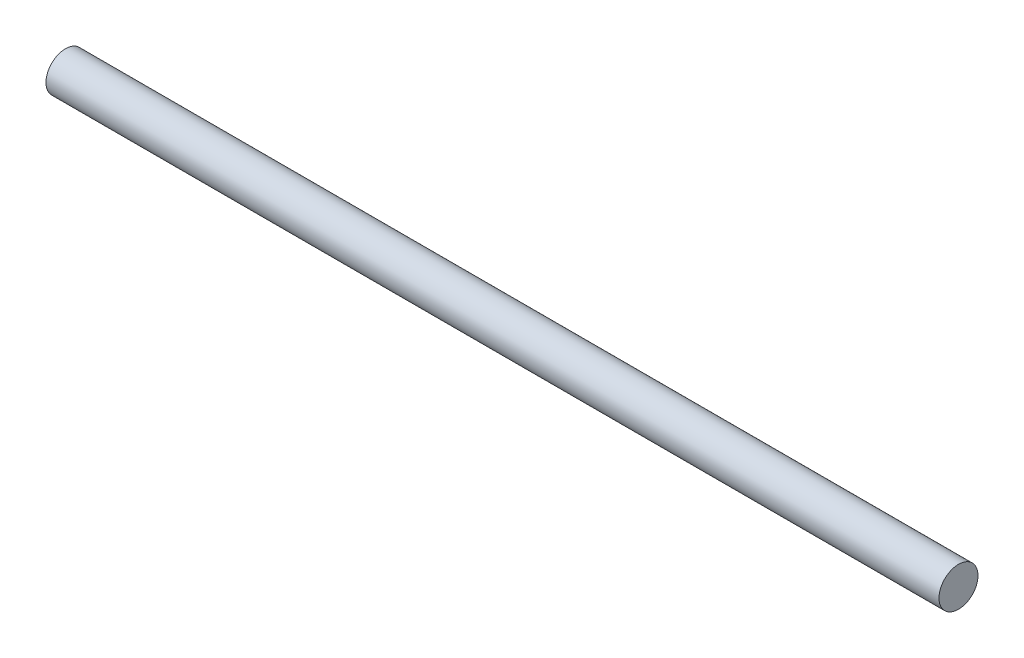
from build123d import *

# Parameters (mm, degrees)
SKETCH1_R           = 0.2921
BOSS_EXTRUDE1_DEPTH = 13.37


with BuildPart() as part:
    # Sketch1 → Boss-Extrude1 (new body)
    with BuildSketch(Plane(origin=(0, 0, 0), x_dir=(0, 0, -1), z_dir=(1, 0, 0))):
        Circle(SKETCH1_R)
    extrude(amount=BOSS_EXTRUDE1_DEPTH)


solid = part.part
